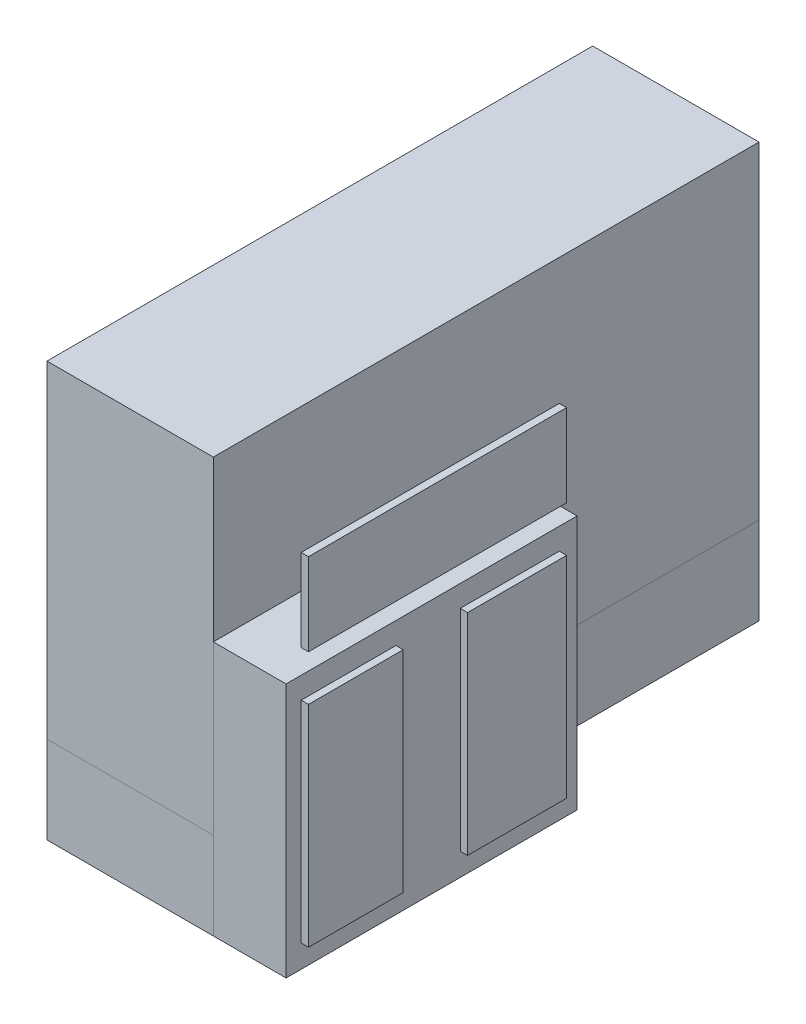
from build123d import *

# Parameters (mm, degrees)
SKETCH_1_W        = 228.6
SKETCH_1_H        = 750
EXTRUDE_465_DEPTH = 120
SKETCH_3_W        = 228.6
SKETCH_3_H        = 750
EXTRUDE_18_DEPTH  = 450
SKETCH_5_W        = 200
SKETCH_5_H        = 350
EXTRUDE_1_DEPTH   = 100
SKETCH_8_W        = 200
SKETCH_8_H        = 350
EXTRUDE_2_DEPTH   = 100
SKETCH_9_W        = 130.14571021
SKETCH_9_H        = 289.102302833
SKETCH_9_W_2      = 136.106582433
SKETCH_9_W_3      = 354.67189729
SKETCH_9_H_2      = 113.256572244
EXTRUDE_2_2_DEPTH = 10


with BuildPart() as part:
    # 草图1 → Extrude 465 (new body)
    with BuildSketch(Plane(origin=(0, 0, 0), x_dir=(1, 0, 0), z_dir=(0, 1, 0))):
        with Locations((114.3, 375)):
            Rectangle(SKETCH_1_W, SKETCH_1_H)
    extrude(amount=EXTRUDE_465_DEPTH)


with BuildPart() as body_2:
    # 草图3 → 18寸墙体 (new body)
    with BuildSketch(Plane(origin=(0, 120, 0), x_dir=(1, 0, 0), z_dir=(0, 1, 0))):
        with Locations((114.3, 375)):
            Rectangle(SKETCH_3_W, SKETCH_3_H)
    extrude(amount=EXTRUDE_18_DEPTH)


with BuildPart() as body_3:
    # 草图5 → 液晶挂壁1 (new body)
    with BuildSketch(Plane(origin=(228.6, 0, 0), x_dir=(0, 0, -1), z_dir=(1, 0, 0))):
        with Locations((100, 175)):
            Rectangle(SKETCH_5_W, SKETCH_5_H)
    extrude(amount=EXTRUDE_1_DEPTH)



with BuildPart() as body_4:
    # 草图8 → Extrude 2 (new body)
    with BuildSketch(Plane(origin=(228.6, 0, 0), x_dir=(0, 0, -1), z_dir=(1, 0, 0))):
        with Locations((300, 175)):
            Rectangle(SKETCH_8_W, SKETCH_8_H)
    extrude(amount=EXTRUDE_2_DEPTH)


with BuildPart() as body_3_1:
    add(body_3.part)

    add(body_4.part)  # Extrude 2 2 merges body 4
    # 草图9 → Extrude 2 2 (add)
    with BuildSketch(Plane(origin=(328.6, 0, 0), x_dir=(0, 0, -1), z_dir=(1, 0, 0))):
        with Locations((85.897697167, 175.717342572)):
            Rectangle(SKETCH_9_W, SKETCH_9_H)
        with Locations((307.443448136, 175.717342572)):
            Rectangle(SKETCH_9_W_2, SKETCH_9_H)
        with Locations((198.160790707, 439.485938455)):
            Rectangle(SKETCH_9_W_3, SKETCH_9_H_2)
    extrude(amount=EXTRUDE_2_2_DEPTH)


solid = Compound([part.part, body_2.part, body_3_1.part])
